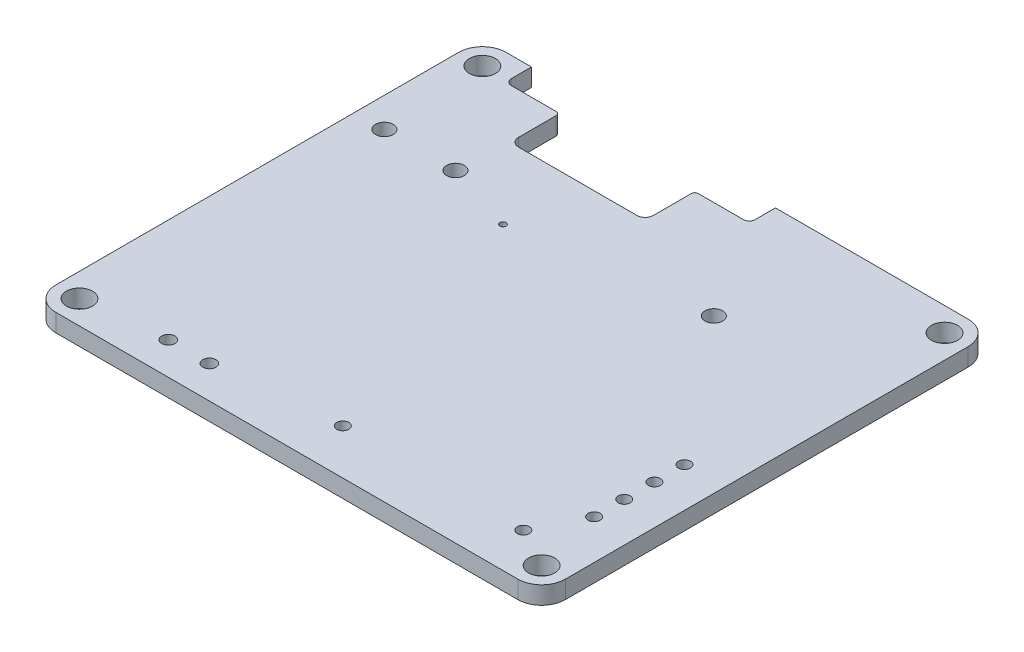
from build123d import *

# Parameters (mm, degrees)
BOSS_EXTRUDE1_DEPTH = 1.5
CAVITY1_START       = -19
CAVITY1_DEPTH       = 6.2
CAVITY1_2_DEPTH     = 2.01
CUT_EXTRUDE3_REACH  = 30.732
SKETCH5_R           = 1.1
CUT_EXTRUDE6_DEPTH  = 1.5
SKETCH6_W           = 2.5
SKETCH6_H           = 6.3
CUT_EXTRUDE7_DEPTH  = 0.01
SKETCH7_R           = 0.75
CUT_EXTRUDE8_DEPTH  = 1.5
SKETCH8_OUTSIDE_W   = 56.48
SKETCH8_OUTSIDE_H   = 51.48
SKETCH8_OUTSIDE_R   = 0.555
CUT_EXTRUDE9_DEPTH  = 1.5
SKETCH9_R           = 0.75
SKETCH9_R_2         = 0.508
SKETCH9_R_3         = 0.262351118
CUT_EXTRUDE10_DEPTH = 1.5


# Read off the part's stored shape, not the designer's step: Cavity1
with BuildPart() as part:
    # Sketch1 → Boss-Extrude1 (new body)
    with BuildSketch(Plane(origin=(0, 0, 0), x_dir=(1, 0, 0), z_dir=(0, 1, 0))):
        with BuildLine():
            Line((-19.5, 19), (19.5, 19))
            ThreePointArc((19.5, 19), (20.914213562, 18.414213562), (21.5, 17))
            Line((21.5, 17), (21.5, -17))
            ThreePointArc((21.5, -17), (20.914213562, -18.414213562), (19.5, -19))
            Line((19.5, -19), (-19.5, -19))
            ThreePointArc((-19.5, -19), (-20.914213562, -18.414213562), (-21.5, -17))
            Line((-21.5, -17), (-21.5, 17))
            ThreePointArc((-21.5, 17), (-20.914213562, 18.414213562), (-19.5, 19))
        make_face()
    extrude(amount=BOSS_EXTRUDE1_DEPTH)

    # Cavity1 outline → Cavity1 (cut)
    with BuildSketch(Plane.XY.offset(CAVITY1_START)):
        with BuildLine():
            ThreePointArc((-11.428721681, 1.5), (-12.051521733, 0.792798554), (-12.560917691, 0))
            Line((-12.560917691, 0), (-1.565146914, 0))
            ThreePointArc((-1.565146914, 0), (-2.074542872, 0.792798554), (-2.697342924, 1.5))
            Line((-2.697342924, 1.5), (-11.428721681, 1.5))
        make_face()
    extrude(amount=CAVITY1_DEPTH, mode=Mode.SUBTRACT)

    # Cavity1 2 outline → Cavity1 2 (cut)
    with BuildSketch(Plane.XY.offset(CAVITY1_START)):
        with BuildLine():
            Line((-17.158032303, 1.5), (-17.158032303, 0))
            Line((-17.158032303, 0), (-12.560917691, 0))
            ThreePointArc((-12.560917691, 0), (-12.051521733, 0.792798554), (-11.428721681, 1.5))
            Line((-11.428721681, 1.5), (-17.158032303, 1.5))
        make_face()
        with BuildLine():
            ThreePointArc((-2.697342924, 1.5), (-2.074542872, 0.792798554), (-1.565146914, 0))
            Line((-1.565146914, 0), (3.031967697, 0))
            Line((3.031967697, 0), (3.031967697, 1.5))
            Line((3.031967697, 1.5), (-2.697342924, 1.5))
        make_face()
    extrude(amount=CAVITY1_2_DEPTH, mode=Mode.SUBTRACT)

    # Cut-Extrude3: up to this face of the body (flat: up to its plane)
    cut_extrude3_end = Plane(part.part.faces().sort_by_distance((0.396422331, 0, 0.917486048))[0])
    # Sketch4 → Cut-Extrude3 (cut, up to the picked face)
    with BuildSketch(Plane(origin=(0, 1.5, 0), x_dir=(1, 0, 0), z_dir=(0, 1, 0)), mode=Mode.PRIVATE) as cut_extrude3_sk1:
        with BuildLine():
            Line((-16.858032303, 16.79), (-13.060917691, 16.79))
            ThreePointArc((-13.060917691, 16.79), (-12.848785657, 16.702132034), (-12.760917691, 16.49))
            Line((-12.760917691, 16.49), (-12.760917691, 13.3))
            ThreePointArc((-12.760917691, 13.3), (-12.555892438, 12.805025253), (-12.060917691, 12.6))
            Line((-12.060917691, 12.6), (-2.065146914, 12.6))
            ThreePointArc((-2.065146914, 12.6), (-1.570172167, 12.805025253), (-1.365146914, 13.3))
            Line((-1.365146914, 13.3), (-1.365146914, 16.49))
            ThreePointArc((-1.365146914, 16.49), (-1.277278948, 16.702132034), (-1.065146914, 16.79))
            Line((-1.065146914, 16.79), (2.739051684, 16.79))
            ThreePointArc((2.739051684, 16.79), (3.08759594, 16.934371758), (3.231967697, 17.282916013))
            Line((3.231967697, 17.282916013), (3.231967697, 19.2))
            Line((3.231967697, 19.2), (-17.358032303, 19.2))
            Line((-17.358032303, 19.2), (-17.358032303, 17.29))
            ThreePointArc((-17.358032303, 17.29), (-17.211585693, 16.936446609), (-16.858032303, 16.79))
        make_face()
    cut_extrude3_tool1 = split(extrude(cut_extrude3_sk1.sketch, amount=-CUT_EXTRUDE3_REACH, mode=Mode.PRIVATE), bisect_by=cut_extrude3_end, keep=Keep.BOTH, mode=Mode.PRIVATE)
    add(cut_extrude3_tool1.solids().sort_by(Axis((-7.062875, 1.5, -16.384158), (0, -1, 0)))[0], mode=Mode.SUBTRACT)

    # Sketch5 → Cut-Extrude6 (cut)
    with BuildSketch(Plane(origin=(0, 1.5, 0), x_dir=(1, 0, 0), z_dir=(0, 1, 0))):
        with Locations(Location((19.5, 17, 0), (0, 0, 270))):
            Circle(SKETCH5_R)
        with Locations(Location((19.5, -17, 0), (0, 0, 270))):
            Circle(SKETCH5_R)
        with Locations(Location((-19.5, 17, 0), (0, 0, 270))):
            Circle(SKETCH5_R)
        with Locations(Location((-19.5, -17, 0), (0, 0, 270))):
            Circle(SKETCH5_R)
    extrude(amount=-CUT_EXTRUDE6_DEPTH, mode=Mode.SUBTRACT)

    # Sketch6 → Cut-Extrude7 (cut)
    with BuildSketch(Plane.XZ):
        with Locations((-10.046489819, -9.45)):
            Rectangle(SKETCH6_W, SKETCH6_H)
        with Locations((-4.079574786, -9.45)):
            Rectangle(SKETCH6_W, SKETCH6_H)
    extrude(amount=-CUT_EXTRUDE7_DEPTH, mode=Mode.SUBTRACT)

    # Sketch7 → Cut-Extrude8 (cut)
    with BuildSketch(Plane(origin=(0, 1.5, 0), x_dir=(1, 0, 0), z_dir=(0, 1, 0))):
        with Locations(Location((-13, 8.22889094, 0), (0, 0, 270))):
            Circle(SKETCH7_R)
        with Locations(Location((-19, 8.22889094, 0), (0, 0, 270))):
            Circle(SKETCH7_R)
    extrude(amount=-CUT_EXTRUDE8_DEPTH, mode=Mode.SUBTRACT)

    # Sketch8 outside → Cut-Extrude9 (cut)
    # profile 1 of 3: a face of its own
    with BuildSketch(Plane(origin=(0, 1.5, 0), x_dir=(1, 0, 0), z_dir=(0, 1, 0))):
        Rectangle(SKETCH8_OUTSIDE_W, SKETCH8_OUTSIDE_H)
        with BuildLine():
            Line((-17.358032303, 17.29), (-17.358032303, 19))
            Line((-17.358032303, 19), (-19.5, 19))
            ThreePointArc((-19.5, 19), (-20.914213562, 18.414213562), (-21.5, 17))
            Line((-21.5, 17), (-21.5, -17))
            ThreePointArc((-21.5, -17), (-20.914213562, -18.414213562), (-19.5, -19))
            Line((-19.5, -19), (19.5, -19))
            ThreePointArc((19.5, -19), (20.914213562, -18.414213562), (21.5, -17))
            Line((21.5, -17), (21.5, 17))
            ThreePointArc((21.5, 17), (20.914213562, 18.414213562), (19.5, 19))
            Line((19.5, 19), (3.231967697, 19))
            Line((3.231967697, 19), (3.231967697, 17.282916013))
            ThreePointArc((3.231967697, 17.282916013), (3.08759594, 16.934371758), (2.739051684, 16.79))
            Line((2.739051684, 16.79), (-1.065146914, 16.79))
            ThreePointArc((-1.065146914, 16.79), (-1.277278948, 16.702132034), (-1.365146914, 16.49))
            Line((-1.365146914, 16.49), (-1.365146914, 13.3))
            ThreePointArc((-1.365146914, 13.3), (-1.570172167, 12.805025253), (-2.065146914, 12.6))
            Line((-2.065146914, 12.6), (-12.060917691, 12.6))
            ThreePointArc((-12.060917691, 12.6), (-12.555892438, 12.805025253), (-12.760917691, 13.3))
            Line((-12.760917691, 13.3), (-12.760917691, 16.49))
            ThreePointArc((-12.760917691, 16.49), (-12.848785657, 16.702132034), (-13.060917691, 16.79))
            Line((-13.060917691, 16.79), (-16.858032303, 16.79))
            ThreePointArc((-16.858032303, 16.79), (-17.211585693, 16.936446609), (-17.358032303, 17.29))
        make_face(mode=Mode.SUBTRACT)
    # profile 2 of 3: a face of its own
    with BuildSketch(Plane(origin=(0, 1.5, 0), x_dir=(1, 0, 0), z_dir=(0, 1, 0))):
        with Locations(Location((-12.744728974, -16.255, 0), (0, 0, 270))):
            Circle(SKETCH8_OUTSIDE_R)
    # profile 3 of 3: a face of its own
    with BuildSketch(Plane(origin=(0, 1.5, 0), x_dir=(1, 0, 0), z_dir=(0, 1, 0))):
        with Locations(Location((-9.284728974, -16.255, 0), (0, 0, 270))):
            Circle(SKETCH8_OUTSIDE_R)
    extrude(amount=-CUT_EXTRUDE9_DEPTH, mode=Mode.SUBTRACT)

    # Sketch9 → Cut-Extrude10 (cut)
    with BuildSketch(Plane.XZ):
        with Locations(Location((8.53007963, -8.501636461, 0), (0, 0, 270))):
            Circle(SKETCH9_R)
        with Locations(Location((18.158240781, 11.226709095, 0), (0, 0, 270))):
            Circle(SKETCH9_R_2)
        with Locations(Location((18.158240781, 8.686709095, 0), (0, 0, 270))):
            Circle(SKETCH9_R_2)
        with Locations(Location((18.158240781, 6.146709095, 0), (0, 0, 270))):
            Circle(SKETCH9_R_2)
        with Locations(Location((18.158240781, 3.606709095, 0), (0, 0, 270))):
            Circle(SKETCH9_R_2)
        with Locations(Location((16.15007963, 15.19, 0), (0, 0, 270))):
            Circle(SKETCH9_R_2)
        with Locations(Location((-7.063032303, -6.3, 0), (0, 0, 270))):
            Circle(SKETCH9_R_3)
        with Locations(Location((0.91007963, 15.19, 0), (0, 0, 270))):
            Circle(SKETCH9_R_2)
    extrude(amount=-CUT_EXTRUDE10_DEPTH, mode=Mode.SUBTRACT)


solid = part.part
